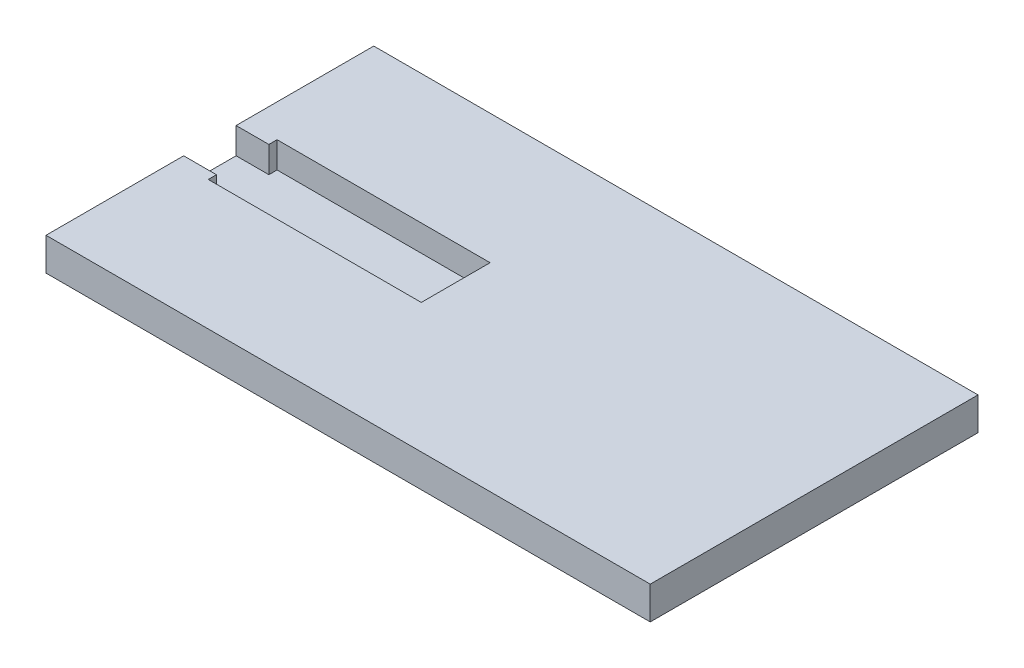
from build123d import *

# Parameters (mm, degrees)
SKETCH_1_W          = 92.18
SKETCH_1_H          = 50
EXTRUDE_1_DEPTH     = 5
CUT_EXTRUDE_1_DEPTH = 4


with BuildPart() as part:
    # 草圖1 → 填料-伸長1 (new body)
    with BuildSketch(Plane(origin=(0, 0, 0), x_dir=(1, 0, 0), z_dir=(0, 1, 0))):
        Rectangle(SKETCH_1_W, SKETCH_1_H)
    extrude(amount=EXTRUDE_1_DEPTH)

    # 草圖2 → 除料-伸長1 (cut)
    with BuildSketch(Plane(origin=(0, 5, 0), x_dir=(1, 0, 0), z_dir=(0, 1, 0))):
        Polygon((-41.09, 5.25), (-8.59, 5.25), (-8.59, -5.25), (-41.09, -5.25), (-41.09, -4), (-46.09, -4), (-46.09, 4), (-41.09, 4), align=None)
    extrude(amount=-CUT_EXTRUDE_1_DEPTH, mode=Mode.SUBTRACT)


solid = part.part
